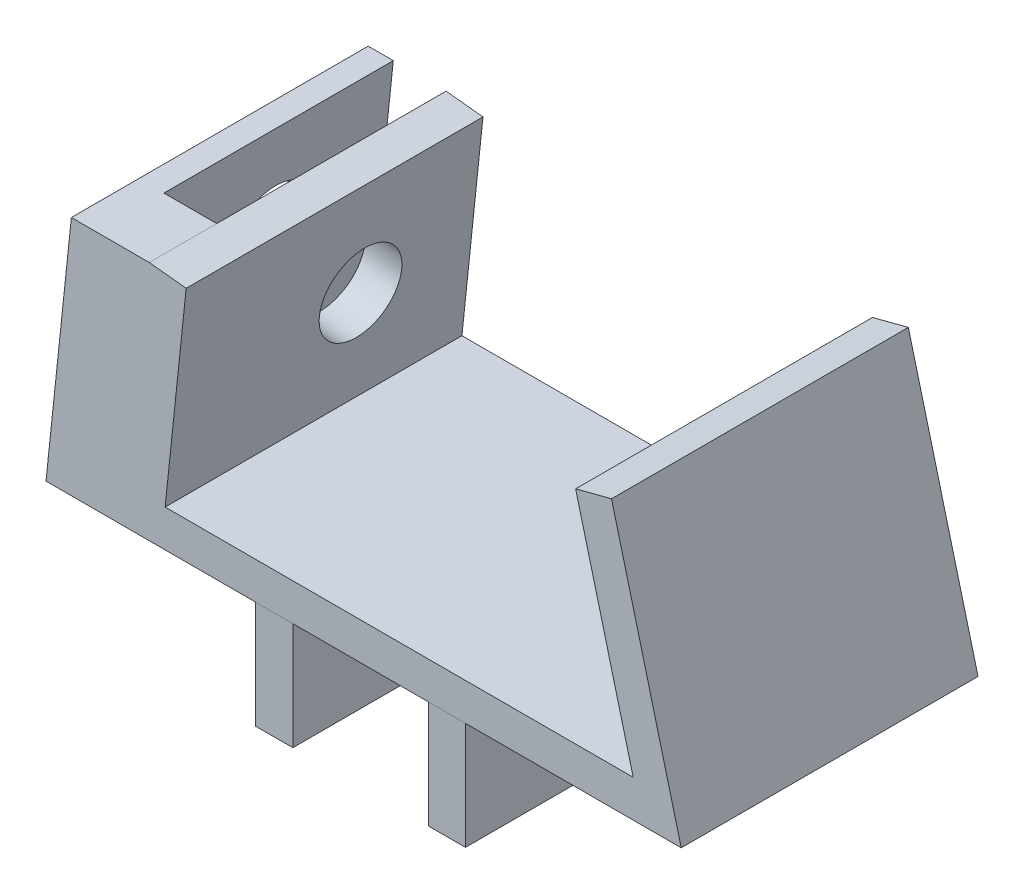
from build123d import *

# Parameters (mm, degrees)
EXTRUDE_THIN1_DEPTH   = 80
SKETCH1_W             = 10
SKETCH1_H             = 38.964166073
EXTRUDE_THIN1_2_DEPTH = 80
EXTRUDE_THIN1_3_DEPTH = 80
BOSS_EXTRUDE1_START   = 61.822225992
BOSS_EXTRUDE1_DEPTH   = 18.177774008
BOSS_EXTRUDE2_DEPTH   = 61.822225992
SKETCH4_R             = 11.100851837
CUT_EXTRUDE1_DEPTH    = 41


# Read off the part's stored shape, not the designer's step: Boss-Extrude1
with BuildPart() as part:
    # Sketch1 → Extrude-Thin1 (new body)
    with BuildSketch(Plane.XY):
        Polygon((-55.798198988, 57.405943705), (-61.472592106, 3.499209089), (64.688081539, 3.499209089), (49.178073684, 63.080336822), (58.855550127, 65.599552912), (77.624528519, -6.500790911), (-72.580472724, -6.500790911), (-65.743253517, 58.45279155), align=None)
    extrude(amount=EXTRUDE_THIN1_DEPTH)

    # Boss-Extrude1 outline → Boss-Extrude1 (add)
    with BuildSketch(Plane.XY.offset(BOSS_EXTRUDE1_START)):
        Polygon((-93.580472724, -6.500790911), (-72.580472724, -6.500790911), (-65.743253517, 58.45279155), (-86.743253517, 58.45279155), align=None)
    extrude(amount=BOSS_EXTRUDE1_DEPTH)

    # Sketch3 → Boss-Extrude2 (add)
    with BuildSketch(Plane(origin=(0, 0, 61.822225992), x_dir=(-1, 0, 0), z_dir=(0, 0, -1))):
        Polygon((93.580472724, -6.500790911), (86.813662715, -6.500790911), (79.976443509, 58.45279155), (86.743253517, 58.45279155), align=None)
    extrude(amount=BOSS_EXTRUDE2_DEPTH)

    # Sketch4 → Cut-Extrude1 (cut)
    with BuildSketch(Plane(origin=(-91.878138626, 9.671383013, 0), x_dir=(0, 0, 1), z_dir=(-0.994505452921406, 0.10468478451804275, 0))):
        with Locations(Location((30.121319387, 23.679594918, 0), (0, 0, 270))):
            Circle(SKETCH4_R)
    extrude(amount=-CUT_EXTRUDE1_DEPTH, mode=Mode.SUBTRACT)


with BuildPart() as body_2:
    # Sketch1 → Extrude-Thin1 2 (new body)
    with BuildSketch(Plane.XY):
        with Locations((-32.047940526, -15.982873948)):
            Rectangle(SKETCH1_W, SKETCH1_H)
    extrude(amount=EXTRUDE_THIN1_2_DEPTH)


with BuildPart() as body_3:
    # Sketch1 → Extrude-Thin1 3 (new body)
    with BuildSketch(Plane.XY):
        with Locations((14.482083037, -15.982873948)):
            Rectangle(SKETCH1_W, SKETCH1_H)
    extrude(amount=EXTRUDE_THIN1_3_DEPTH)


solid = Compound([part.part, body_2.part, body_3.part])
